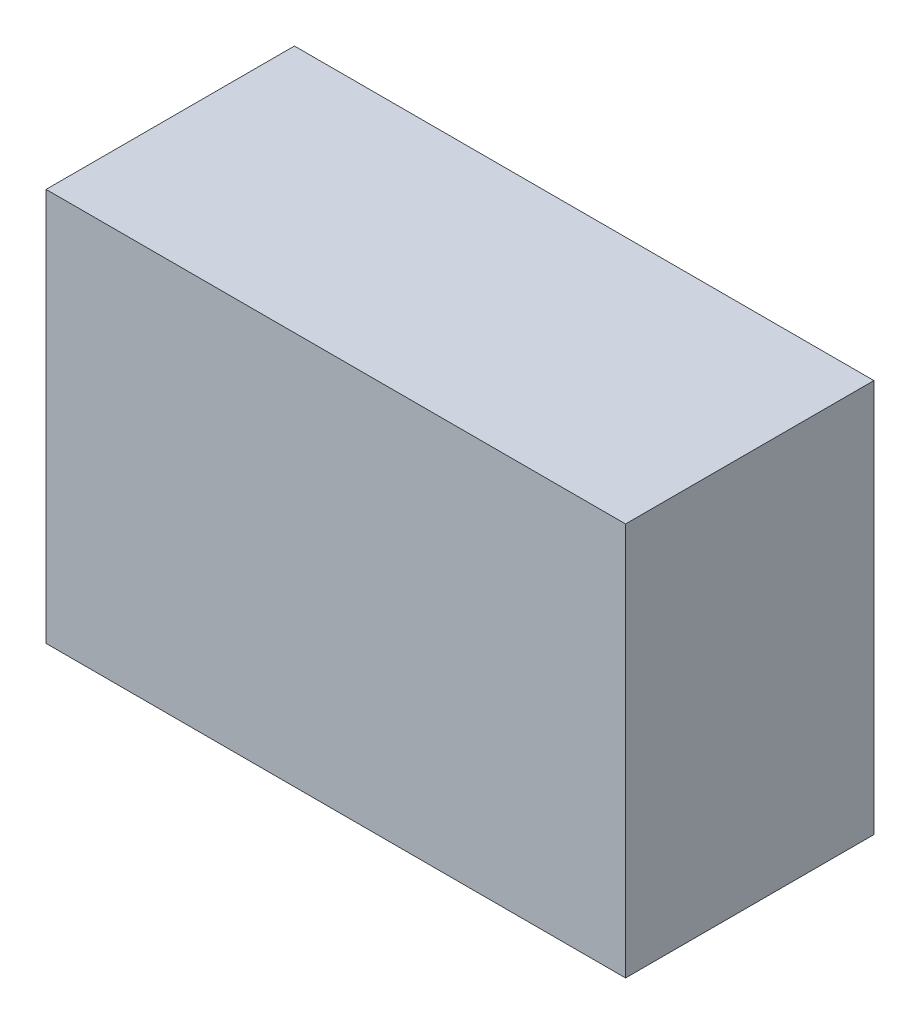
from build123d import *

# Parameters (mm, degrees)
SKETCH1_W           = 711.2
SKETCH1_H           = 482.6
BOSS_EXTRUDE1_DEPTH = 152.4


with BuildPart() as part:
    # Sketch1 → Boss-Extrude1 (new, symmetric)
    with BuildSketch(Plane.XY):
        Rectangle(SKETCH1_W, SKETCH1_H)
    extrude(amount=BOSS_EXTRUDE1_DEPTH, both=True)


solid = part.part
